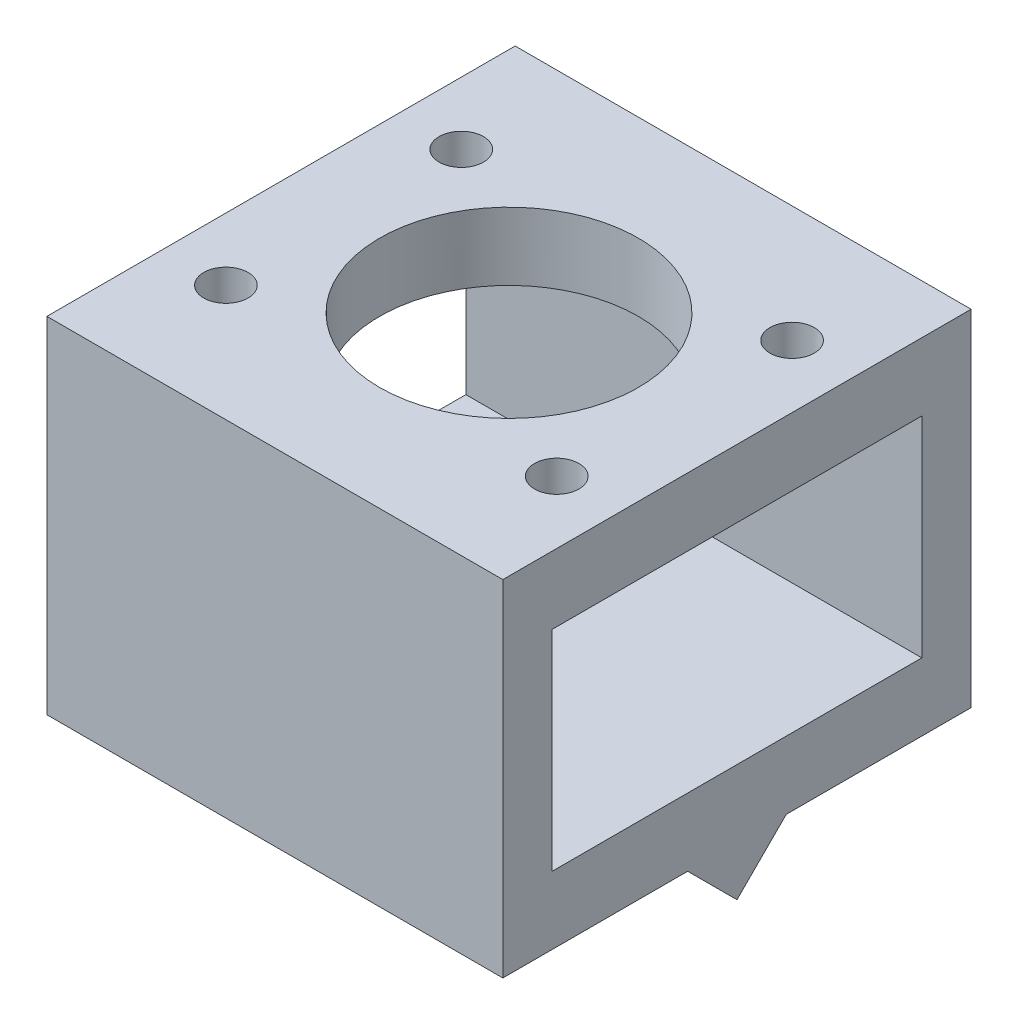
from build123d import *

# Parameters (mm, degrees)
SKETCH2_W           = 30
SKETCH2_H           = 17
BOSS_EXTRUDE1_DEPTH = 37
CUT_EXTRUDE1_REACH  = 54.479
SKETCH3_R           = 1.8
SKETCH3_R_2         = 10.5


with BuildPart() as part:
    # Sketch2 → Boss-Extrude1 (new body)
    with BuildSketch(Plane(origin=(0, 0, 0), x_dir=(0, 0, -1), z_dir=(1, 0, 0))):
        Polygon((19, -14), (3.999996995, -14), (0, -17.999996995), (-3.999996995, -14), (-19, -14), (-19, 14), (19, 14), align=None)
        Rectangle(SKETCH2_W, SKETCH2_H, mode=Mode.SUBTRACT)
    extrude(amount=BOSS_EXTRUDE1_DEPTH)

    # Sketch3 → Cut-Extrude1 (cut, up to next)
    with BuildSketch(Plane(origin=(0, 14, 0), x_dir=(1, 0, 0), z_dir=(0, 1, 0)), mode=Mode.PRIVATE) as cut_extrude1_sk1:
        with Locations((5.07661, -9.55)):
            Circle(SKETCH3_R)
    cut_extrude1_tool1 = extrude(cut_extrude1_sk1.sketch, amount=-CUT_EXTRUDE1_REACH, mode=Mode.PRIVATE) & part.part
    # Sketch3 → Cut-Extrude1 (cut, up to next)
    with BuildSketch(Plane(origin=(0, 14, 0), x_dir=(1, 0, 0), z_dir=(0, 1, 0)), mode=Mode.PRIVATE) as cut_extrude1_sk2:
        with Locations((5.07661, 9.55)):
            Circle(SKETCH3_R)
    cut_extrude1_tool2 = extrude(cut_extrude1_sk2.sketch, amount=-CUT_EXTRUDE1_REACH, mode=Mode.PRIVATE) & part.part
    # Sketch3 → Cut-Extrude1 (cut, up to next)
    with BuildSketch(Plane(origin=(0, 14, 0), x_dir=(1, 0, 0), z_dir=(0, 1, 0)), mode=Mode.PRIVATE) as cut_extrude1_sk3:
        with Locations((31.92339, -9.55)):
            Circle(SKETCH3_R)
    cut_extrude1_tool3 = extrude(cut_extrude1_sk3.sketch, amount=-CUT_EXTRUDE1_REACH, mode=Mode.PRIVATE) & part.part
    # Sketch3 → Cut-Extrude1 (cut, up to next)
    with BuildSketch(Plane(origin=(0, 14, 0), x_dir=(1, 0, 0), z_dir=(0, 1, 0)), mode=Mode.PRIVATE) as cut_extrude1_sk4:
        with Locations((31.92339, 9.55)):
            Circle(SKETCH3_R)
    cut_extrude1_tool4 = extrude(cut_extrude1_sk4.sketch, amount=-CUT_EXTRUDE1_REACH, mode=Mode.PRIVATE) & part.part
    # Sketch3 → Cut-Extrude1 (cut, up to next)
    with BuildSketch(Plane(origin=(0, 14, 0), x_dir=(1, 0, 0), z_dir=(0, 1, 0)), mode=Mode.PRIVATE) as cut_extrude1_sk5:
        with Locations((18.5, 0)):
            Circle(SKETCH3_R_2)
    cut_extrude1_tool5 = extrude(cut_extrude1_sk5.sketch, amount=-CUT_EXTRUDE1_REACH, mode=Mode.PRIVATE) & part.part
    add(cut_extrude1_tool1.solids().sort_by_distance((5.07661, 14, 9.55))[0], mode=Mode.SUBTRACT)
    add(cut_extrude1_tool2.solids().sort_by_distance((5.07661, 14, -9.55))[0], mode=Mode.SUBTRACT)
    add(cut_extrude1_tool3.solids().sort_by_distance((31.92339, 14, 9.55))[0], mode=Mode.SUBTRACT)
    add(cut_extrude1_tool4.solids().sort_by_distance((31.92339, 14, -9.55))[0], mode=Mode.SUBTRACT)
    add(cut_extrude1_tool5.solids().sort_by_distance((18.5, 14, 0))[0], mode=Mode.SUBTRACT)


solid = part.part
